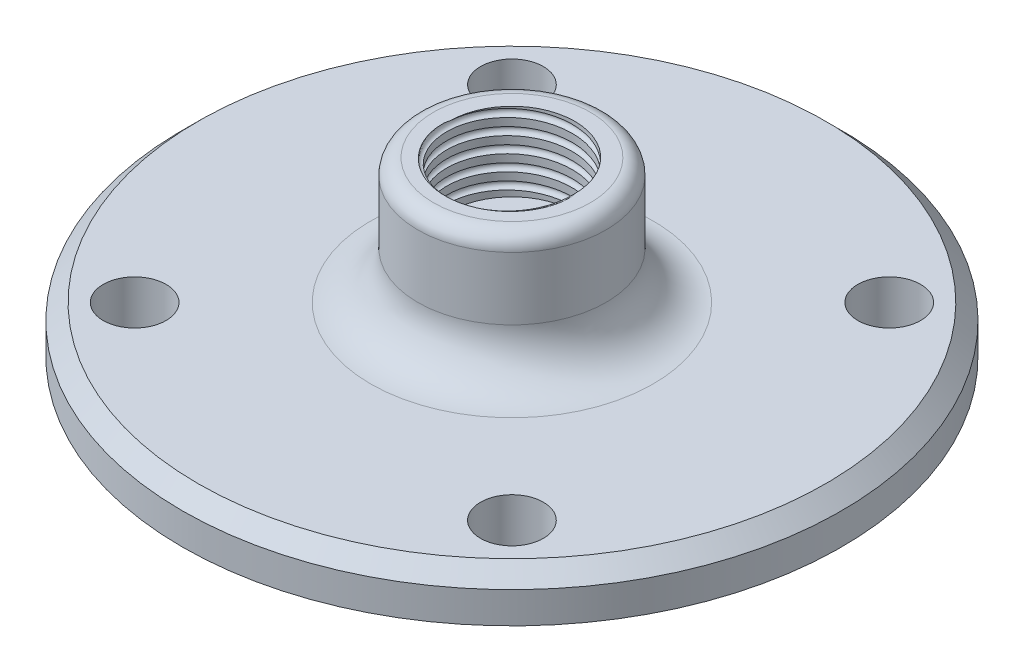
from build123d import *

# Parameters (mm, degrees)
SKETCH1_R           = 21
SKETCH1_R_2         = 6
SKETCH1_R_3         = 2
BOSS_EXTRUDE1_DEPTH = 3
SKETCH1_3_R         = 6
SKETCH1_3_R_2       = 4
BOSS_EXTRUDE2_DEPTH = 11
SKETCH1_4_R         = 4
SKETCH1_4_R_2       = 2.5
BOSS_EXTRUDE3_DEPTH = 6
FILLET1_R           = 3
SKETCH2_R           = 12
BOSS_EXTRUDE4_DEPTH = 1
SKETCH1_5_R         = 2.5
CUT_EXTRUDE1_DEPTH  = 32.670175244
FILLET2_R           = 1
CHAMFER1_SIZE       = 1
CUT_SWEEP2_PITCH    = 1
CUT_SWEEP2_TO       = 5


with BuildPart() as part:
    # Sketch1 → Boss-Extrude1 (new body)
    with BuildSketch(Plane(origin=(0, 0, 0), x_dir=(1, 0, 0), z_dir=(0, 1, 0))):
        with Locations(Location((0, 0, 0), (0, 0, 270))):
            Circle(SKETCH1_R)
        with Locations(Location((0, 0, 0), (0, 0, 270))):
            Circle(SKETCH1_R_2, mode=Mode.SUBTRACT)
        with Locations(Location((-12.02081528, -12.02081528, 0), (0, 0, 270))):
            Circle(SKETCH1_R_3, mode=Mode.SUBTRACT)
        with Locations(Location((12.02081528, -12.02081528, 0), (0, 0, 270))):
            Circle(SKETCH1_R_3, mode=Mode.SUBTRACT)
        with Locations(Location((12.02081528, 12.02081528, 0), (0, 0, 270))):
            Circle(SKETCH1_R_3, mode=Mode.SUBTRACT)
        with Locations(Location((-12.02081528, 12.02081528, 0), (0, 0, 270))):
            Circle(SKETCH1_R_3, mode=Mode.SUBTRACT)
    extrude(amount=BOSS_EXTRUDE1_DEPTH)

    # Sketch1<3> → Boss-Extrude2 (add)
    with BuildSketch(Plane(origin=(0, 0, 0), x_dir=(1, 0, 0), z_dir=(0, 1, 0))):
        with Locations(Location((0, 0, 0), (0, 0, 270))):
            Circle(SKETCH1_3_R)
        with Locations(Location((0, 0, 0), (0, 0, 270))):
            Circle(SKETCH1_3_R_2, mode=Mode.SUBTRACT)
    extrude(amount=BOSS_EXTRUDE2_DEPTH)

    # Sketch1<4> → Boss-Extrude3 (add)
    with BuildSketch(Plane(origin=(0, 0, 0), x_dir=(1, 0, 0), z_dir=(0, 1, 0))):
        with Locations(Location((0, 0, 0), (0, 0, 270))):
            Circle(SKETCH1_4_R)
        with Locations(Location((0, 0, 0), (0, 0, 270))):
            Circle(SKETCH1_4_R_2, mode=Mode.SUBTRACT)
    extrude(amount=BOSS_EXTRUDE3_DEPTH)

    # Fillet1
    fillet1_edges = [part.edges().sort_by_distance(p)[0] for p in [
        (0, 3, -6),
    ]]
    fillet(fillet1_edges, radius=FILLET1_R)

    # Sketch2 → Boss-Extrude4 (add)
    with BuildSketch(Plane.XZ):
        with Locations(Location((0, 0, 0), (0, 0, 90))):
            Circle(SKETCH2_R)
    extrude(amount=BOSS_EXTRUDE4_DEPTH)

    # Sketch1<5> → Cut-Extrude1 (cut, through all)
    with BuildSketch(Plane(origin=(0, 0, 0), x_dir=(1, 0, 0), z_dir=(0, 1, 0))):
        with Locations(Location((0, 0, 0), (0, 0, 270))):
            Circle(SKETCH1_5_R)
    extrude(amount=-CUT_EXTRUDE1_DEPTH, mode=Mode.SUBTRACT)

    # Fillet2
    fillet2_edges = [part.edges().sort_by_distance(p)[0] for p in [
        (0, 11, -6),
    ]]
    fillet(fillet2_edges, radius=FILLET2_R)

    # Chamfer1
    chamfer1_edges = [part.edges().sort_by_distance(p)[0] for p in [
        (0, 3, -21),
    ]]
    chamfer(chamfer1_edges, length=CHAMFER1_SIZE)

    # Cut-Sweep2: arcs per turn and ends read off the stored shape
    # Cut-Sweep2: the profile of Sketch5 screwed along a right-hand helix through 6.5 turns, 8 arcs to a turn; built about Z, then put on its axis
    cut_sweep2_z = Axis((0, 0, 0), (0, 0, 1))
    cut_sweep2_corners = [(3.75, 0, -1), (4, 0, -1.25), (4.25, 0, -1), (4, 0, -0.75)]
    with BuildLine(mode=Mode.PRIVATE) as cut_sweep2_profile:
        ThreePointArc((3.75, 0, -1), (3.823223305, 0, -1.176776695), (4, 0, -1.25))
        ThreePointArc((4, 0, -1.25), (4.176776695, 0, -1.176776695), (4.25, 0, -1))
        ThreePointArc((4.25, 0, -1), (4.176776695, 0, -0.823223305), (4, 0, -0.75))
        ThreePointArc((4, 0, -0.75), (3.823223305, 0, -0.823223305), (3.75, 0, -1))
    cut_sweep2_cap = Face(cut_sweep2_profile.wire())
    cut_sweep2_arcs = [((3.75, 0, -1), (3.75, 0, -1.25), (4, 0, -1.25), (1, 0.7071067811865476, 1)), ((4, 0, -1.25), (4.25, 0, -1.25), (4.25, 0, -1), (1, 0.7071067811865476, 1)), ((4.25, 0, -1), (4.25, 0, -0.75), (4, 0, -0.75), (1, 0.7071067811865476, 1)), ((4, 0, -0.75), (3.75, 0, -0.75), (3.75, 0, -1), (1, 0.7071067811865476, 1))]  # start, shoulder, end, weights
    cut_sweep2_turn_angles = [0, 22.5, 45, 67.5, 90, 112.5, 135, 157.5, 180, 202.5, 225, 247.5, 270, 292.5, 315, 337.5, 360]
    cut_sweep2_turn_weights = [1, 0.9238795325112867, 1, 0.9238795325112867, 1, 0.9238795325112867, 1, 0.9238795325112867, 1, 0.9238795325112867, 1, 0.9238795325112867, 1, 0.9238795325112867, 1, 0.9238795325112867, 1]
    cut_sweep2_turn_sides = [Face.make_bezier_surface([[Vector(p[j][0], p[j][1], 0).rotate(cut_sweep2_z, cut_sweep2_turn_angles[2 * i + k]) / cut_sweep2_turn_weights[2 * i + k] + Vector(0, 0, p[j][2] + CUT_SWEEP2_PITCH * cut_sweep2_turn_angles[2 * i + k] / 360) for k in range(3)] for j in range(3)], [[p[3][j] * cut_sweep2_turn_weights[2 * i + k] for k in range(3)] for j in range(3)]) for p in cut_sweep2_arcs for i in range(8)]
    cut_sweep2_last_angles = [2160, 2182.5, 2205, 2227.5, 2250, 2272.5, 2295, 2317.5, 2340]
    cut_sweep2_last_weights = [1, 0.9238795325112867, 1, 0.9238795325112867, 1, 0.9238795325112867, 1, 0.9238795325112867, 1]
    cut_sweep2_last_sides = [Face.make_bezier_surface([[Vector(p[j][0], p[j][1], 0).rotate(cut_sweep2_z, cut_sweep2_last_angles[2 * i + k]) / cut_sweep2_last_weights[2 * i + k] + Vector(0, 0, p[j][2] + CUT_SWEEP2_PITCH * cut_sweep2_last_angles[2 * i + k] / 360) for k in range(3)] for j in range(3)], [[p[3][j] * cut_sweep2_last_weights[2 * i + k] for k in range(3)] for j in range(3)]) for p in cut_sweep2_arcs for i in range(4)]
    cut_sweep2 = Plane(origin=(0, 11, 0), x_dir=(0, 0, 1), z_dir=(0, -1, 0)) * split(Solid(Shell([*[p.moved(Location((0, 0, CUT_SWEEP2_PITCH * i))) for i in range(6) for p in cut_sweep2_turn_sides], *cut_sweep2_last_sides, cut_sweep2_cap, cut_sweep2_cap.rotate(cut_sweep2_z, 2340).moved(Location((0, 0, CUT_SWEEP2_PITCH * 2340 / 360)))])), bisect_by=Plane.XY.offset(CUT_SWEEP2_TO), keep=Keep.BOTTOM, mode=Mode.PRIVATE)
    add(cut_sweep2, mode=Mode.SUBTRACT)


solid = part.part
